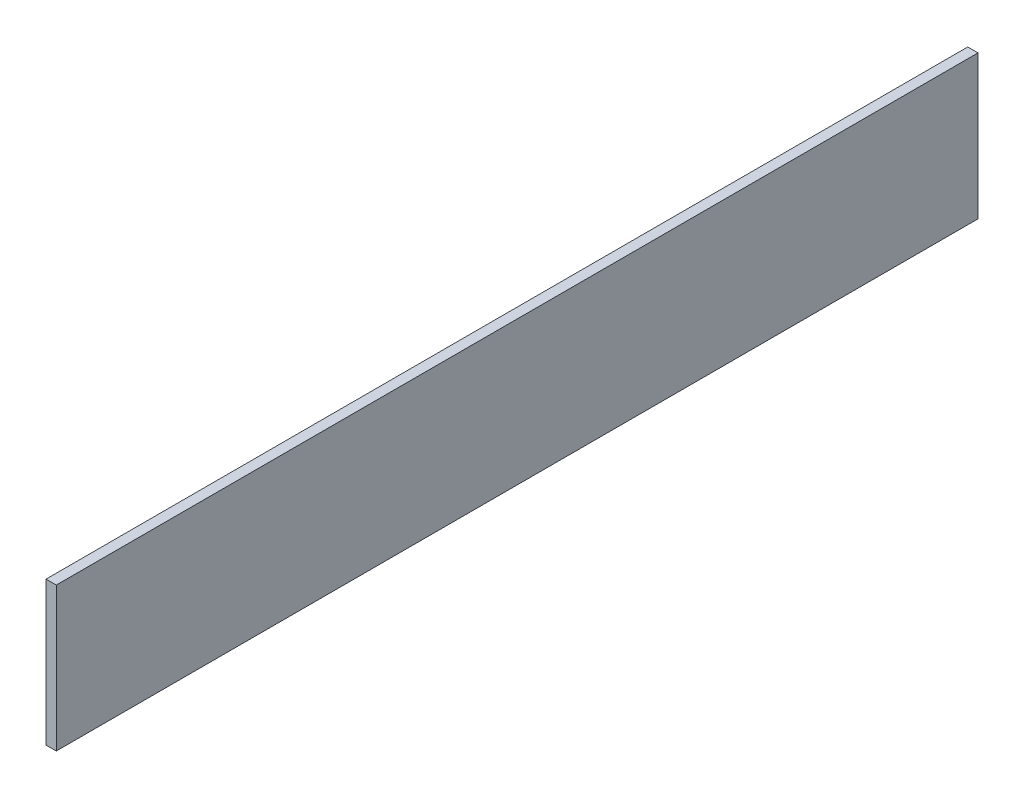
from build123d import *

# Parameters (mm, degrees)
ESQUISSE1_W        = 570
ESQUISSE1_H        = 88.9
BOSS_EXTRU_1_DEPTH = 6.35


with BuildPart() as part:
    # Esquisse1 → Boss.-Extru.1 (new body)
    with BuildSketch(Plane(origin=(0, 0, 0), x_dir=(0, 0, -1), z_dir=(1, 0, 0))):
        Rectangle(ESQUISSE1_W, ESQUISSE1_H)
    extrude(amount=BOSS_EXTRU_1_DEPTH)


solid = part.part
